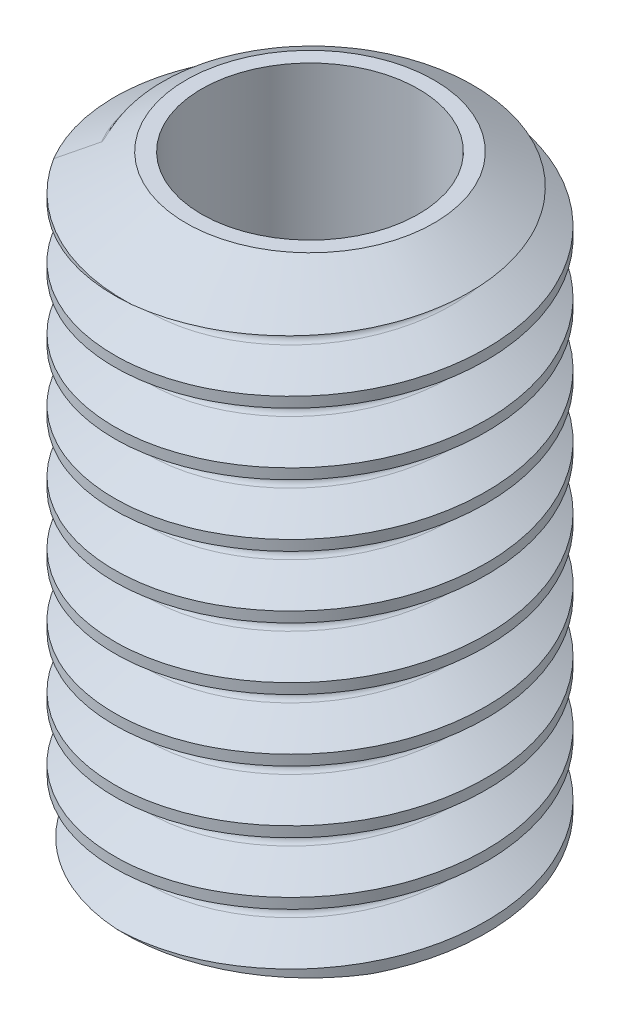
from build123d import *

# Parameters (mm, degrees)
SKETCH1_R           = 3
BOSS_EXTRUDE1_DEPTH = 10
CUT_SWEEP1_PITCH    = 1
SKETCH5_R           = 1.75
CUT_EXTRUDE3_DEPTH  = 11.862780649


with BuildPart() as part:
    # Sketch1 → Boss-Extrude1 (new body)
    with BuildSketch(Plane(origin=(0, 0, 0), x_dir=(1, 0, 0), z_dir=(0, 1, 0))):
        with Locations(Location((0, 0, 0), (0, 0, 270))):
            Circle(SKETCH1_R)
    extrude(amount=BOSS_EXTRUDE1_DEPTH)

    # Cut-Sweep1: the profile of Sketch4 profile screwed along a right-hand helix of 12 turns, 8 arcs to a turn; built about Z, then put on its axis
    cut_sweep1_z = Axis((0, 0, 0), (0, 0, 1))
    cut_sweep1_corners = [(2.440626588, 0, -0.09375), (3.0003, 0, -0.416877595), (3.0003, 0, 0.416877595), (2.440626588, 0, 0.09375), (2.3865, 0, 0)]
    with BuildLine(mode=Mode.PRIVATE) as cut_sweep1_profile:
        Line(cut_sweep1_corners[0], cut_sweep1_corners[1])
        Line(cut_sweep1_corners[1], cut_sweep1_corners[2])
        Line(cut_sweep1_corners[2], cut_sweep1_corners[3])
        ThreePointArc((2.440626588, 0, 0.09375), (2.401003175, 0, 0.054126588), (2.3865, 0, 0))
        ThreePointArc((2.3865, 0, 0), (2.401003175, 0, -0.054126588), (2.440626588, 0, -0.09375))
    cut_sweep1_cap = Face(cut_sweep1_profile.wire())
    cut_sweep1_arcs = [((2.440626588, 0, 0.09375), (2.3865, 0, 0.0625), (2.3865, 0, 0), (1, 0.8660254037844395, 1)), ((2.3865, 0, 0), (2.3865, 0, -0.0625), (2.440626588, 0, -0.09375), (1, 0.8660254037844395, 1))]  # start, shoulder, end, weights
    cut_sweep1_turn_angles = [0, 22.5, 45, 67.5, 90, 112.5, 135, 157.5, 180, 202.5, 225, 247.5, 270, 292.5, 315, 337.5, 360]
    cut_sweep1_turn_weights = [1, 0.9238795325112867, 1, 0.9238795325112867, 1, 0.9238795325112867, 1, 0.9238795325112867, 1, 0.9238795325112867, 1, 0.9238795325112867, 1, 0.9238795325112867, 1, 0.9238795325112867, 1]
    cut_sweep1_turn_rails = [Edge.make_bspline([Vector(p[0], p[1], 0).rotate(cut_sweep1_z, cut_sweep1_turn_angles[k]) / cut_sweep1_turn_weights[k] + Vector(0, 0, p[2] + CUT_SWEEP1_PITCH * cut_sweep1_turn_angles[k] / 360) for k in range(17)], [0, 0, 0, 1, 1, 2, 2, 3, 3, 4, 4, 5, 5, 6, 6, 7, 7, 8, 8, 8], 2, cut_sweep1_turn_weights) for p in cut_sweep1_corners]
    cut_sweep1_turn_sides = [*[Face.make_surface_from_curves(cut_sweep1_turn_rails[p[0]], cut_sweep1_turn_rails[p[1]]) for p in [(0, 1), (1, 2), (2, 3)]], *[Face.make_bezier_surface([[Vector(p[j][0], p[j][1], 0).rotate(cut_sweep1_z, cut_sweep1_turn_angles[2 * i + k]) / cut_sweep1_turn_weights[2 * i + k] + Vector(0, 0, p[j][2] + CUT_SWEEP1_PITCH * cut_sweep1_turn_angles[2 * i + k] / 360) for k in range(3)] for j in range(3)], [[p[3][j] * cut_sweep1_turn_weights[2 * i + k] for k in range(3)] for j in range(3)]) for p in cut_sweep1_arcs for i in range(8)]]
    cut_sweep1 = Plane(origin=(0, 11, 0), x_dir=(0, 0, 1), z_dir=(0, -1, 0)) * Solid(Shell([*[p.moved(Location((0, 0, CUT_SWEEP1_PITCH * i))) for i in range(12) for p in cut_sweep1_turn_sides], cut_sweep1_cap, cut_sweep1_cap.rotate(cut_sweep1_z, 4320).moved(Location((0, 0, CUT_SWEEP1_PITCH * 4320 / 360)))]))
    add(cut_sweep1, mode=Mode.SUBTRACT)

    # Sketch5 → Cut-Extrude3 (cut, through all)
    with BuildSketch(Plane(origin=(0, 0, 0), x_dir=(1, 0, 0), z_dir=(0, 1, 0))):
        with Locations(Location((0, 0, 0), (0, 0, 270))):
            Circle(SKETCH5_R)
    extrude(amount=CUT_EXTRUDE3_DEPTH, mode=Mode.SUBTRACT)

    # Sketch6 → Cut-Revolve1 (revolve, cut)
    with BuildSketch(Plane(origin=(0, 0, 0), x_dir=(0, 0, -1), z_dir=(1, 0, 0))):
        Polygon((3, 10), (2, 10), (3, 9.422649731), align=None)
        Polygon((3, 0), (2, 0), (3, 0.577350269), align=None)
    revolve(axis=Axis((0, 0, 0), (0, 1, 0)), mode=Mode.SUBTRACT)


solid = part.part
